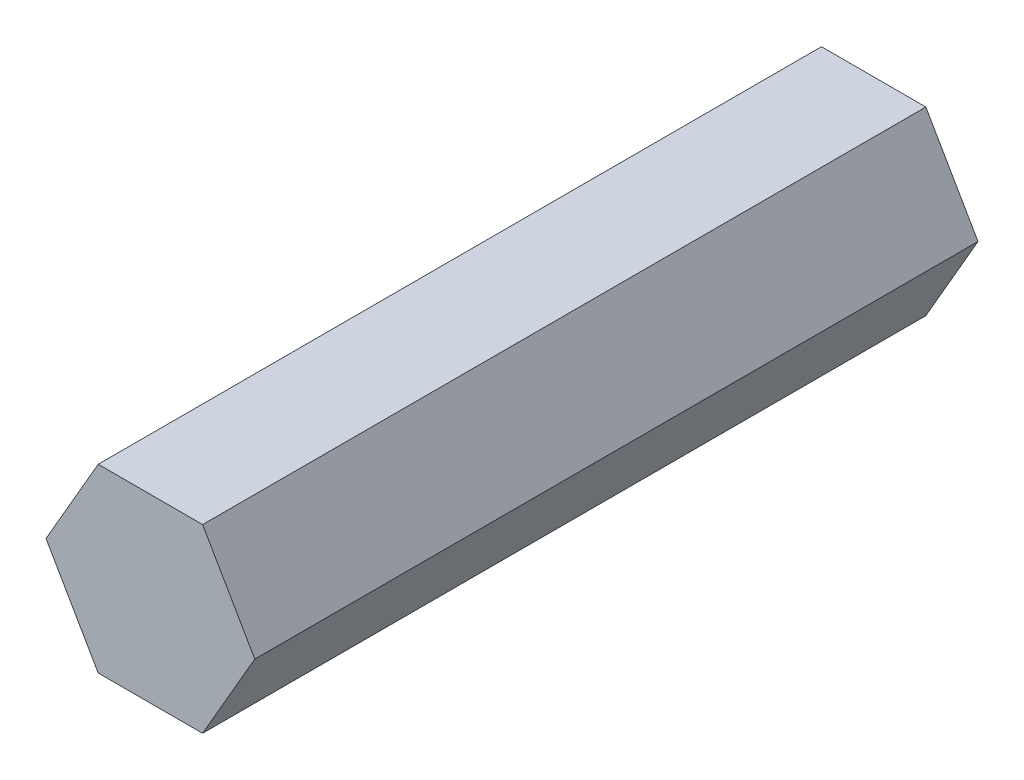
from build123d import *

# Parameters (mm, degrees)
BOSS_EXTRUDE1_DEPTH = 50.8


with BuildPart() as part:
    # Sketch1 → Boss-Extrude1 (new body)
    with BuildSketch(Plane.XY):
        Polygon((3.663549428, -6.351514695), (7.332347792, -0.003030475), (3.668798364, 6.34848422), (-3.663549428, 6.351514695), (-7.332347792, 0.003030475), (-3.668798364, -6.34848422), align=None)
    extrude(amount=BOSS_EXTRUDE1_DEPTH)


solid = part.part
